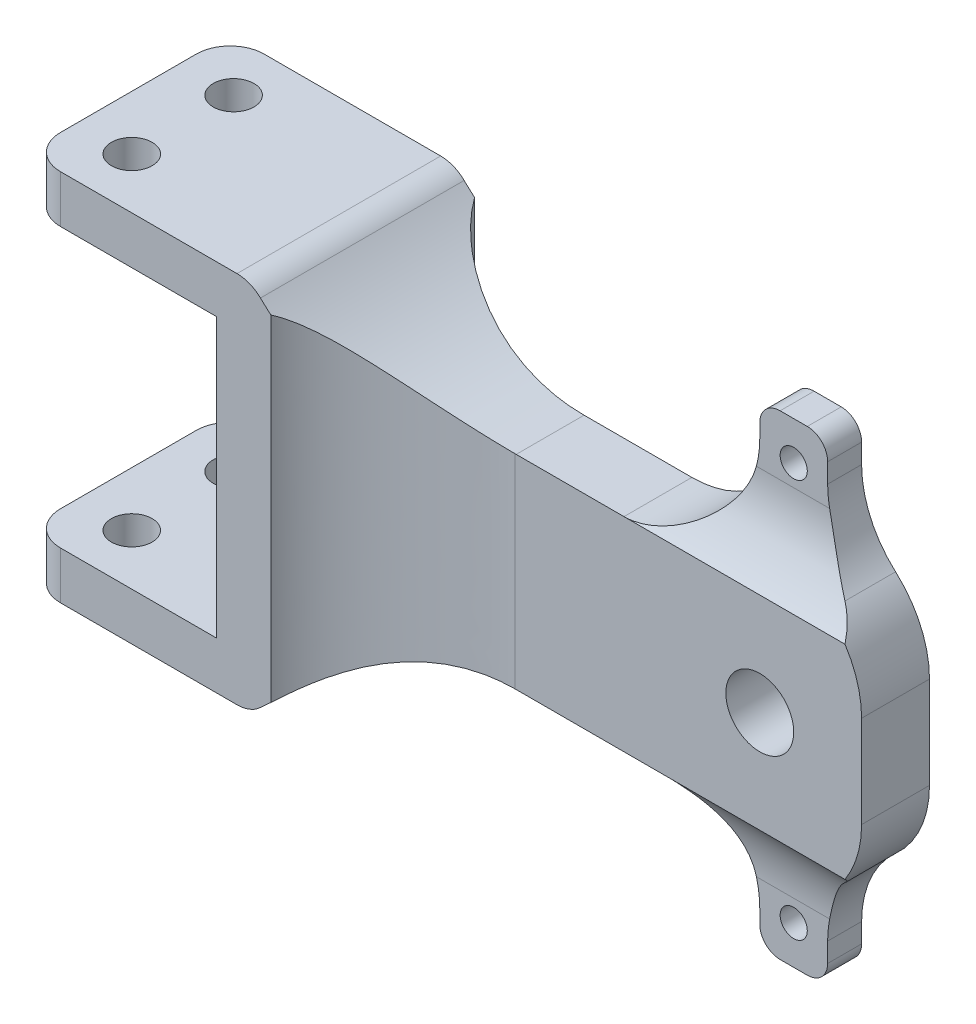
from build123d import *

# Parameters (mm, degrees)
SKETCH_1_W             = 85
SKETCH_1_H             = 30
EXTRUDE_1_DEPTH        = 10
CUT_EXTRUDE_1_REACH    = 92.692
SKETCH_2_R             = 5
EXTRUDE_2_DEPTH        = 10
EXTRUDE_2_DEPTH_BACK   = 20
SKETCH_3_W             = 8
SKETCH_3_H             = 30
SKETCH_5_W             = 8
SKETCH_5_H             = 30
EXTRUDE_3_DEPTH        = 12.5
SKETCH_6_W             = 30
SKETCH_6_H             = 7
EXTRUDE_4_DEPTH        = 28
CUT_EXTRUDE_2_REACH    = 99.115
SKETCH_7_R             = 3
FILLET_1_R             = 5
FILLET_1_OF_MIRROR_1_R = 5
FILLET_2_DEPTH         = 30
FILLET_3_DEPTH         = 30
FILLET_4_DEPTH         = 10
FILLET_START           = -9.709779072
FILLET_4_2_DEPTH       = 49.419558144
FILLET_START_2         = -11
FILLET_4_3_DEPTH       = 32
FILLET_START_3         = -10
FILLET_4_4_DEPTH       = 30
SKETCH_8_W             = 10
SKETCH_8_H             = 5
EXTRUDE_5_DEPTH        = 20
FILLET_5_R             = 15
SKETCH_9_R             = 2
CUT_EXTRUDE_3_DEPTH    = 20
FILLET_6_R             = 3
FILLET_6_OF_MIRROR_3_R = 3
FILLET_7_R             = 15
FILLET_8_R             = 15


with BuildPart() as part:
    # 草图1 → 凸台-拉伸1 (new body)
    with BuildSketch(Plane.XY):
        with Locations((42.5, 15)):
            Rectangle(SKETCH_1_W, SKETCH_1_H)
    extrude(amount=EXTRUDE_1_DEPTH)

    # 草图2 → 切除-拉伸1 (cut, up to next)
    with BuildSketch(Plane(origin=(0, 0, 0), x_dir=(-1, 0, 0), z_dir=(0, 0, -1)), mode=Mode.PRIVATE) as cut_extrude_1_sk1:
        with Locations((-70, 15)):
            Circle(SKETCH_2_R)
    cut_extrude_1_tool1 = extrude(cut_extrude_1_sk1.sketch, amount=-CUT_EXTRUDE_1_REACH, mode=Mode.PRIVATE) & part.part
    add(cut_extrude_1_tool1.solids().sort_by_distance((70, 15, 0))[0], mode=Mode.SUBTRACT)



with BuildPart() as body_2:
    # 草图3 → 凸台-拉伸2 (new, two sides: drawn at the far end of the back side and taken through both)
    with BuildSketch(Plane.XY.offset(10).offset(-EXTRUDE_2_DEPTH_BACK)):
        with Locations((4, 15)):
            Rectangle(SKETCH_3_W, SKETCH_3_H)
    extrude(amount=EXTRUDE_2_DEPTH + EXTRUDE_2_DEPTH_BACK)


with BuildPart() as part_1:
    add(part.part)

    add(body_2.part)  # 凸台-拉伸3 merges body 2
    # 草图5 → 凸台-拉伸3 (add)
    with BuildSketch(Plane(origin=(0, 30, 0), x_dir=(1, 0, 0), z_dir=(0, 1, 0))):
        with Locations((4, -5)):
            Rectangle(SKETCH_5_W, SKETCH_5_H)
    extrude_3 = extrude(amount=EXTRUDE_3_DEPTH)

    # 草图6 → 凸台-拉伸4 (add)
    with BuildSketch(Plane.ZY):
        with Locations((5, 39)):
            Rectangle(SKETCH_6_W, SKETCH_6_H)
    extrude_4 = extrude(amount=EXTRUDE_4_DEPTH)

    # 草图7 → 切除-拉伸2 (cut, up to next)
    with BuildSketch(Plane(origin=(0, 42.5, 0), x_dir=(1, 0, 0), z_dir=(0, 1, 0)), mode=Mode.PRIVATE) as cut_extrude_2_sk1:
        with Locations(Location((-20, 2.5, 0), (0, 0, 270))):
            Circle(SKETCH_7_R)
    cut_extrude_2_tool1 = extrude(cut_extrude_2_sk1.sketch, amount=-CUT_EXTRUDE_2_REACH, mode=Mode.PRIVATE) & part_1.part
    # 草图7 → 切除-拉伸2 (cut, up to next)
    with BuildSketch(Plane(origin=(0, 42.5, 0), x_dir=(1, 0, 0), z_dir=(0, 1, 0)), mode=Mode.PRIVATE) as cut_extrude_2_sk2:
        with Locations(Location((-20, -12.5, 0), (0, 0, 270))):
            Circle(SKETCH_7_R)
    cut_extrude_2_tool2 = extrude(cut_extrude_2_sk2.sketch, amount=-CUT_EXTRUDE_2_REACH, mode=Mode.PRIVATE) & part_1.part
    cut_extrude_2_1 = cut_extrude_2_tool1.solids().sort_by_distance((-20, 42.5, -2.5))[0]
    add(cut_extrude_2_1, mode=Mode.SUBTRACT)
    cut_extrude_2_2 = cut_extrude_2_tool2.solids().sort_by_distance((-20, 42.5, 12.5))[0]
    add(cut_extrude_2_2, mode=Mode.SUBTRACT)
    cut_extrude_2 = cut_extrude_2_1 + cut_extrude_2_2  # 切除-拉伸2 as one shape, for the pattern or mirror that repeats it

    # 圆角1
    fillet_1_edges = [part_1.edges().sort_by_distance(p)[0] for p in [
        (8, 42.5, 5),
        (-28, 39, -10),
        (-28, 39, 20),
    ]]
    fillet(fillet_1_edges, radius=FILLET_1_R)

    # 镜向1: 凸台-拉伸3, 凸台-拉伸4, 切除-拉伸2 across plane
    add(extrude_3.mirror(Plane.ZX.offset(15)))
    add(extrude_4.mirror(Plane.ZX.offset(15)))
    add(cut_extrude_2.mirror(Plane.ZX.offset(15)), mode=Mode.SUBTRACT)

    # 圆角1 of 镜向1
    fillet_1_of_mirror_1_edges = [part_1.edges().sort_by_distance(p)[0] for p in [
        (8, -12.5, 5),
        (-28, -9, -10),
        (-28, -9, 20),
    ]]
    fillet(fillet_1_of_mirror_1_edges, radius=FILLET_1_OF_MIRROR_1_R)

    # 圆角2: read off the stored shape, not the designer's step
    # 圆角2 outline → 圆角2 (add)
    with BuildSketch(Plane(origin=(0, 0, 0), x_dir=(1, 0, 0), z_dir=(0, 1, 0))):
        with BuildLine():
            add(Edge.make_bspline(
                [(33.980762114, -10), (13.773502692, -10), (8, -20)],
                knots=[0, 0, 0, 1, 1, 1], degree=2, weights=[1, 0.866025404, 1]))
            Line((33.980762114, -10), (8, -10))
            Line((8, -10), (8, -20))
        make_face()
    extrude(amount=FILLET_2_DEPTH)

    # 圆角3: read off the stored shape, not the designer's step
    # 圆角3 outline → 圆角3 (add)
    with BuildSketch(Plane(origin=(0, 0, 0), x_dir=(1, 0, 0), z_dir=(0, 1, 0))):
        with BuildLine():
            Line((8, 0), (33.980762114, 0))
            add(Edge.make_bspline(
                [(33.980762114, 0), (13.773502692, 0), (8, 10)],
                knots=[0, 0, 0, 1, 1, 1], degree=2, weights=[1, 0.866025404, 1]))
            Line((8, 10), (8, 0))
        make_face()
    extrude(amount=FILLET_3_DEPTH)

    # 圆角4: read off the stored shape, not the designer's step
    # 圆角4 outline → 圆角4 (add)
    with BuildSketch(Plane.XY):
        with BuildLine():
            ThreePointArc((6.458305444, -11.111111111), (19.217629145, -2.881570914), (34.124748995, 0))
            Line((34.124748995, 0), (8, 0))
            Line((8, 0), (8, -7.5))
            ThreePointArc((8, -7.5), (7.598452306, -9.463220922), (6.458305444, -11.111111111))
        make_face()
        with BuildLine():
            ThreePointArc((34.124748995, 30), (19.217629145, 32.881570914), (6.458305444, 41.111111111))
            ThreePointArc((6.458305444, 41.111111111), (7.598452306, 39.463220922), (8, 37.5))
            Line((8, 37.5), (8, 30))
            Line((8, 30), (34.124748995, 30))
        make_face()
    extrude(amount=FILLET_4_DEPTH)

    # Fillet 4 2 outline → Fillet 4 2 (add)
    with BuildSketch(Plane(origin=(0, 0, 0), x_dir=(1, 0, 0), z_dir=(0, 1, 0)).offset(FILLET_START)):
        with BuildLine():
            add(Edge.make_bspline(
                [(33.980762114, -10), (13.773502692, -10), (8, -20)],
                knots=[0, 0, 0, 1, 1, 1], degree=2, weights=[1, 0.866025404, 1]))
            Line((33.980762114, -10), (8, -10))
            Line((8, -10), (8, -20))
        make_face()
        with BuildLine():
            Line((8, 0), (33.980762114, 0))
            add(Edge.make_bspline(
                [(33.980762114, 0), (13.773502692, 0), (8, 10)],
                knots=[0, 0, 0, 1, 1, 1], degree=2, weights=[1, 0.866025404, 1]))
            Line((8, 10), (8, 0))
        make_face()
    extrude(amount=FILLET_4_2_DEPTH)

    # Fillet 4 3 outline → Fillet 4 3 (cut)
    with BuildSketch(Plane.XY.offset(FILLET_START_2)):
        with BuildLine():
            Line((35, 0), (34.124748995, 0))
            ThreePointArc((34.124748995, 0), (20.189341563, -2.505941541), (7.99999995, -9.709779014))
            ThreePointArc((7.99999995, -9.709779014), (7.220027604, -10.400405968), (6.458305444, -11.111111111))
            Line((6.458305444, -11.111111111), (5, -12.507707754))
            Line((5, -12.507707754), (5, -13))
            Line((5, -13), (35, -13))
            Line((35, -13), (35, 0))
        make_face()
        with BuildLine():
            Line((34.124748995, 30), (35, 30))
            Line((35, 30), (35, 43))
            Line((35, 43), (5, 43))
            Line((5, 43), (5, 42.507707754))
            Line((5, 42.507707754), (6.458305444, 41.111111111))
            ThreePointArc((6.458305444, 41.111111111), (7.220027604, 40.400405968), (7.99999995, 39.709779014))
            ThreePointArc((7.99999995, 39.709779014), (20.189341563, 32.505941541), (34.124748995, 30))
        make_face()
    extrude(amount=FILLET_4_3_DEPTH, mode=Mode.SUBTRACT)

    # Fillet 4 4 outline → Fillet 4 4 (add)
    with BuildSketch(Plane.XY.offset(FILLET_START_3)):
        with BuildLine():
            ThreePointArc((6.458305444, -11.111111111), (7.220027604, -10.400405968), (7.99999995, -9.709779014))
            Line((7.99999995, -9.709779014), (8, -7.5))
            ThreePointArc((8, -7.5), (7.598452306, -9.463220922), (6.458305444, -11.111111111))
        make_face()
        with BuildLine():
            Line((8, 37.5), (7.99999995, 39.709779014))
            ThreePointArc((7.99999995, 39.709779014), (7.220027604, 40.400405968), (6.458305444, 41.111111111))
            ThreePointArc((6.458305444, 41.111111111), (7.598452306, 39.463220922), (8, 37.5))
        make_face()
    extrude(amount=FILLET_4_4_DEPTH)

    # 草图8 → 凸台-拉伸5 (add)
    with BuildSketch(Plane(origin=(0, 30, 0), x_dir=(1, 0, 0), z_dir=(0, 1, 0))):
        with Locations((70, -2.5)):
            Rectangle(SKETCH_8_W, SKETCH_8_H)
    extrude_5 = extrude(amount=EXTRUDE_5_DEPTH)

    # 圆角5
    # the kernel refuses this fillet: 15 mm, written as the material it adds along each edge
    with BuildSketch(Plane(origin=(65, 30, 5), x_dir=(-1, 0, 0), z_dir=(0, 0, -1))) as fillet_5_piece_1:
        with BuildLine():
            CenterArc((FILLET_5_R, FILLET_5_R), FILLET_5_R, 180, 90)
            Line((0, FILLET_5_R), (-FILLET_5_R * 0.02, FILLET_5_R))
            Line((-FILLET_5_R * 0.02, FILLET_5_R), (-FILLET_5_R * 0.02, -FILLET_5_R * 0.02))
            Line((-FILLET_5_R * 0.02, -FILLET_5_R * 0.02), (FILLET_5_R, -FILLET_5_R * 0.02))
            Line((FILLET_5_R, -FILLET_5_R * 0.02), (FILLET_5_R, 0))
        make_face()
    extrude(amount=5)
    with BuildSketch(Plane(origin=(75, 30, 0), x_dir=(1, 0, 0), z_dir=(0, 0, 1))) as fillet_5_piece_2:
        with BuildLine():
            CenterArc((15, 14.142135624), FILLET_5_R, 180, 70.528779366)
            Line((0, 14.142135624), (-0.3, 14.142135624))
            Line((-0.3, 14.142135624), (-0.3, 0))
            Line((-0.3, 0), (0, -0.3))
            ThreePointArc((0, -0.3), (5, -0.3), (9.9, -0.282842712))
            Line((9.9, -0.282842712), (10, 0))
        make_face()
    extrude(amount=5)
    with BuildSketch(Plane(origin=(75, 30, 5), x_dir=(0, 0, 1), z_dir=(-1, 0, 0))) as fillet_5_piece_3:
        with BuildLine():
            CenterArc((15, 11.180339887), FILLET_5_R, 180, 48.189685104)
            Line((0, 11.180339887), (-0.3, 11.180339887))
            Line((-0.3, 11.180339887), (-0.3, 0))
            Line((-0.3, 0), (0, -0.3))
            ThreePointArc((0, -0.3), (2.5, -0.3), (4.8, -0.223606798))
            Line((4.8, -0.223606798), (5, 0))
        make_face()
    extrude(amount=10)
    with BuildSketch(Plane(origin=(65, 30, 42.5), x_dir=(-1, 0, 0), z_dir=(0, 0, -1))) as fillet_5_piece_4a_section:
        with BuildLine():
            CenterArc((FILLET_5_R, FILLET_5_R), FILLET_5_R, 180, 90)
            Line((0, FILLET_5_R), (-FILLET_5_R * 0.02, FILLET_5_R))
            Line((-FILLET_5_R * 0.02, FILLET_5_R), (-FILLET_5_R * 0.02, -FILLET_5_R * 0.02))
            Line((-FILLET_5_R * 0.02, -FILLET_5_R * 0.02), (FILLET_5_R, -FILLET_5_R * 0.02))
            Line((FILLET_5_R, -FILLET_5_R * 0.02), (FILLET_5_R, 0))
        make_face()
    fillet_5_piece_4a = extrude(amount=42.5, mode=Mode.PRIVATE)
    fillet_5_piece_4a = split(fillet_5_piece_4a, bisect_by=Plane(origin=(65, 30, 10), z_dir=(0, 0, -1)), keep=Keep.TOP, mode=Mode.PRIVATE)
    fillet_5_piece_4a = split(fillet_5_piece_4a, bisect_by=Plane(origin=(65, 30, 5), z_dir=(0, 0, 1)), keep=Keep.TOP, mode=Mode.PRIVATE)
    with BuildSketch(Plane(origin=(75, 30, 5), x_dir=(0, 0, 1), z_dir=(-1, 0, 0))) as fillet_5_piece_4b_section:
        with BuildLine():
            CenterArc((15, 11.180339887), FILLET_5_R, 180, 48.189685104)
            Line((0, 11.180339887), (-0.3, 11.180339887))
            Line((-0.3, 11.180339887), (-0.3, 0))
            Line((-0.3, 0), (0, -0.3))
            ThreePointArc((0, -0.3), (2.5, -0.3), (4.8, -0.223606798))
            Line((4.8, -0.223606798), (5, 0))
        make_face()
    fillet_5_piece_4b = extrude(amount=37.950849719, mode=Mode.PRIVATE)
    fillet_5_piece_4b = split(fillet_5_piece_4b, bisect_by=Plane(origin=(65, 30, 5), z_dir=(-1, 0, 0)), keep=Keep.TOP, mode=Mode.PRIVATE)
    fillet_5_piece_4 = fillet_5_piece_4a & fillet_5_piece_4b
    add(fillet_5_piece_4)
    with BuildSketch(Plane(origin=(102.950849719, 30, 5), x_dir=(0, 0, 1), z_dir=(-1, 0, 0))) as fillet_5_piece_5a_section:
        with BuildLine():
            CenterArc((15, 11.180339887), FILLET_5_R, 180, 48.189685104)
            Line((0, 11.180339887), (-0.3, 11.180339887))
            Line((-0.3, 11.180339887), (-0.3, 0))
            Line((-0.3, 0), (0, -0.3))
            ThreePointArc((0, -0.3), (2.5, -0.3), (4.8, -0.223606798))
            Line((4.8, -0.223606798), (5, 0))
        make_face()
    fillet_5_piece_5a = extrude(amount=37.950849719, mode=Mode.PRIVATE)
    fillet_5_piece_5a = split(fillet_5_piece_5a, bisect_by=Plane(origin=(85, 30, 5), z_dir=(-1, 0, 0)), keep=Keep.TOP, mode=Mode.PRIVATE)
    fillet_5_piece_5a = split(fillet_5_piece_5a, bisect_by=Plane(origin=(75, 30, 5), z_dir=(1, 0, 0)), keep=Keep.TOP, mode=Mode.PRIVATE)
    with BuildSketch(Plane(origin=(75, 30, 0), x_dir=(1, 0, 0), z_dir=(0, 0, 1))) as fillet_5_piece_5b_section:
        with BuildLine():
            CenterArc((15, 14.142135624), FILLET_5_R, 180, 70.528779366)
            Line((0, 14.142135624), (-0.3, 14.142135624))
            Line((-0.3, 14.142135624), (-0.3, 0))
            Line((-0.3, 0), (0, -0.3))
            ThreePointArc((0, -0.3), (5, -0.3), (9.9, -0.282842712))
            Line((9.9, -0.282842712), (10, 0))
        make_face()
    fillet_5_piece_5b = extrude(amount=40.355339059, mode=Mode.PRIVATE)
    fillet_5_piece_5b = split(fillet_5_piece_5b, bisect_by=Plane(origin=(75, 30, 10), z_dir=(0, 0, -1)), keep=Keep.TOP, mode=Mode.PRIVATE)
    fillet_5_piece_5b = split(fillet_5_piece_5b, bisect_by=Plane(origin=(75, 30, 5), z_dir=(0, 0, 1)), keep=Keep.TOP, mode=Mode.PRIVATE)
    fillet_5_piece_5 = fillet_5_piece_5a & fillet_5_piece_5b
    add(fillet_5_piece_5)

    # 草图9 → 切除-拉伸3 (cut)
    with BuildSketch(Plane.XY.offset(5)):
        with Locations((70, 44.33)):
            Circle(SKETCH_9_R)
    cut_extrude_3 = extrude(amount=-CUT_EXTRUDE_3_DEPTH, mode=Mode.SUBTRACT)

    # 圆角6
    fillet_6_edges = [part_1.edges().sort_by_distance(p)[0] for p in [
        (65, 50, 2.5),
        (75, 50, 2.5),
    ]]
    fillet(fillet_6_edges, radius=FILLET_6_R)

    # 镜向3: 凸台-拉伸5, 切除-拉伸3 across plane
    add(extrude_5.mirror(Plane.ZX.offset(15)))
    add(cut_extrude_3.mirror(Plane.ZX.offset(15)), mode=Mode.SUBTRACT)

    # 圆角6 of 镜向3
    fillet_6_of_mirror_3_edges = [part_1.edges().sort_by_distance(p)[0] for p in [
        (65, -20, 2.5),
        (75, -20, 2.5),
    ]]
    fillet(fillet_6_of_mirror_3_edges, radius=FILLET_6_OF_MIRROR_3_R)

    # 圆角7
    # the kernel refuses this fillet: 15 mm, written as the material it adds along each edge
    with BuildSketch(Plane(origin=(65, 0, 5), x_dir=(-1, 0, 0), z_dir=(0, 0, -1))) as fillet_7_piece_1:
        with BuildLine():
            CenterArc((FILLET_7_R, -FILLET_7_R), FILLET_7_R, 90, 90)
            Line((0, -FILLET_7_R), (-FILLET_7_R * 0.02, -FILLET_7_R))
            Line((-FILLET_7_R * 0.02, -FILLET_7_R), (-FILLET_7_R * 0.02, FILLET_7_R * 0.02))
            Line((-FILLET_7_R * 0.02, FILLET_7_R * 0.02), (FILLET_7_R, FILLET_7_R * 0.02))
            Line((FILLET_7_R, FILLET_7_R * 0.02), (FILLET_7_R, 0))
        make_face()
    extrude(amount=5)
    with BuildSketch(Plane(origin=(75, 0, 0), x_dir=(0, -1, 0), z_dir=(0, 0, 1))) as fillet_7_piece_2:
        with BuildLine():
            CenterArc((14.142135624, 15), FILLET_7_R, 199.471220634, 70.528779366)
            Line((0, 10), (-0.282842712, 9.9))
            ThreePointArc((-0.282842712, 9.9), (-0.3, 5), (-0.3, 0))
            Line((-0.3, 0), (0, -0.3))
            Line((0, -0.3), (14.142135624, -0.3))
            Line((14.142135624, -0.3), (14.142135624, 0))
        make_face()
    extrude(amount=5)
    with BuildSketch(Plane(origin=(75, 0, 5), x_dir=(0, 0, 1), z_dir=(-1, 0, 0))) as fillet_7_piece_3:
        with BuildLine():
            CenterArc((15, -11.180339887), FILLET_7_R, 131.810314896, 48.189685104)
            Line((0, -11.180339887), (-0.3, -11.180339887))
            Line((-0.3, -11.180339887), (-0.3, 0))
            Line((-0.3, 0), (0, 0.3))
            ThreePointArc((0, 0.3), (2.5, 0.3), (4.8, 0.223606798))
            Line((4.8, 0.223606798), (5, 0))
        make_face()
    extrude(amount=10)
    with BuildSketch(Plane(origin=(65, 0, 42.5), x_dir=(-1, 0, 0), z_dir=(0, 0, -1))) as fillet_7_piece_4a_section:
        with BuildLine():
            CenterArc((FILLET_7_R, -FILLET_7_R), FILLET_7_R, 90, 90)
            Line((0, -FILLET_7_R), (-FILLET_7_R * 0.02, -FILLET_7_R))
            Line((-FILLET_7_R * 0.02, -FILLET_7_R), (-FILLET_7_R * 0.02, FILLET_7_R * 0.02))
            Line((-FILLET_7_R * 0.02, FILLET_7_R * 0.02), (FILLET_7_R, FILLET_7_R * 0.02))
            Line((FILLET_7_R, FILLET_7_R * 0.02), (FILLET_7_R, 0))
        make_face()
    fillet_7_piece_4a = extrude(amount=42.5, mode=Mode.PRIVATE)
    fillet_7_piece_4a = split(fillet_7_piece_4a, bisect_by=Plane(origin=(65, 0, 10), z_dir=(0, 0, -1)), keep=Keep.TOP, mode=Mode.PRIVATE)
    fillet_7_piece_4a = split(fillet_7_piece_4a, bisect_by=Plane(origin=(65, 0, 5), z_dir=(0, 0, 1)), keep=Keep.TOP, mode=Mode.PRIVATE)
    with BuildSketch(Plane(origin=(75, 0, 5), x_dir=(0, 0, 1), z_dir=(-1, 0, 0))) as fillet_7_piece_4b_section:
        with BuildLine():
            CenterArc((15, -11.180339887), FILLET_7_R, 131.810314896, 48.189685104)
            Line((0, -11.180339887), (-0.3, -11.180339887))
            Line((-0.3, -11.180339887), (-0.3, 0))
            Line((-0.3, 0), (0, 0.3))
            ThreePointArc((0, 0.3), (2.5, 0.3), (4.8, 0.223606798))
            Line((4.8, 0.223606798), (5, 0))
        make_face()
    fillet_7_piece_4b = extrude(amount=37.950849719, mode=Mode.PRIVATE)
    fillet_7_piece_4b = split(fillet_7_piece_4b, bisect_by=Plane(origin=(65, 0, 5), z_dir=(-1, 0, 0)), keep=Keep.TOP, mode=Mode.PRIVATE)
    fillet_7_piece_4 = fillet_7_piece_4a & fillet_7_piece_4b
    add(fillet_7_piece_4)
    with BuildSketch(Plane(origin=(75, 0, 0), x_dir=(0, -1, 0), z_dir=(0, 0, 1))) as fillet_7_piece_5a_section:
        with BuildLine():
            CenterArc((14.142135624, 15), FILLET_7_R, 199.471220634, 70.528779366)
            Line((0, 10), (-0.282842712, 9.9))
            ThreePointArc((-0.282842712, 9.9), (-0.3, 5), (-0.3, 0))
            Line((-0.3, 0), (0, -0.3))
            Line((0, -0.3), (14.142135624, -0.3))
            Line((14.142135624, -0.3), (14.142135624, 0))
        make_face()
    fillet_7_piece_5a = extrude(amount=40.355339059, mode=Mode.PRIVATE)
    fillet_7_piece_5a = split(fillet_7_piece_5a, bisect_by=Plane(origin=(75, 0, 5), z_dir=(0, 0, 1)), keep=Keep.TOP, mode=Mode.PRIVATE)
    fillet_7_piece_5a = split(fillet_7_piece_5a, bisect_by=Plane(origin=(75, 0, 10), z_dir=(0, 0, -1)), keep=Keep.TOP, mode=Mode.PRIVATE)
    with BuildSketch(Plane(origin=(102.950849719, 0, 5), x_dir=(0, 0, 1), z_dir=(-1, 0, 0))) as fillet_7_piece_5b_section:
        with BuildLine():
            CenterArc((15, -11.180339887), FILLET_7_R, 131.810314896, 48.189685104)
            Line((0, -11.180339887), (-0.3, -11.180339887))
            Line((-0.3, -11.180339887), (-0.3, 0))
            Line((-0.3, 0), (0, 0.3))
            ThreePointArc((0, 0.3), (2.5, 0.3), (4.8, 0.223606798))
            Line((4.8, 0.223606798), (5, 0))
        make_face()
    fillet_7_piece_5b = extrude(amount=37.950849719, mode=Mode.PRIVATE)
    fillet_7_piece_5b = split(fillet_7_piece_5b, bisect_by=Plane(origin=(75, 0, 5), z_dir=(1, 0, 0)), keep=Keep.TOP, mode=Mode.PRIVATE)
    fillet_7_piece_5b = split(fillet_7_piece_5b, bisect_by=Plane(origin=(85, 0, 5), z_dir=(-1, 0, 0)), keep=Keep.TOP, mode=Mode.PRIVATE)
    fillet_7_piece_5 = fillet_7_piece_5a & fillet_7_piece_5b
    add(fillet_7_piece_5)

    # 圆角8
    fillet_8_edges = [part_1.edges().sort_by_distance(p)[0] for p in [
        (85, 30, 5),
        (85, 0, 5),
    ]]
    fillet(fillet_8_edges, radius=FILLET_8_R)


solid = part_1.part
